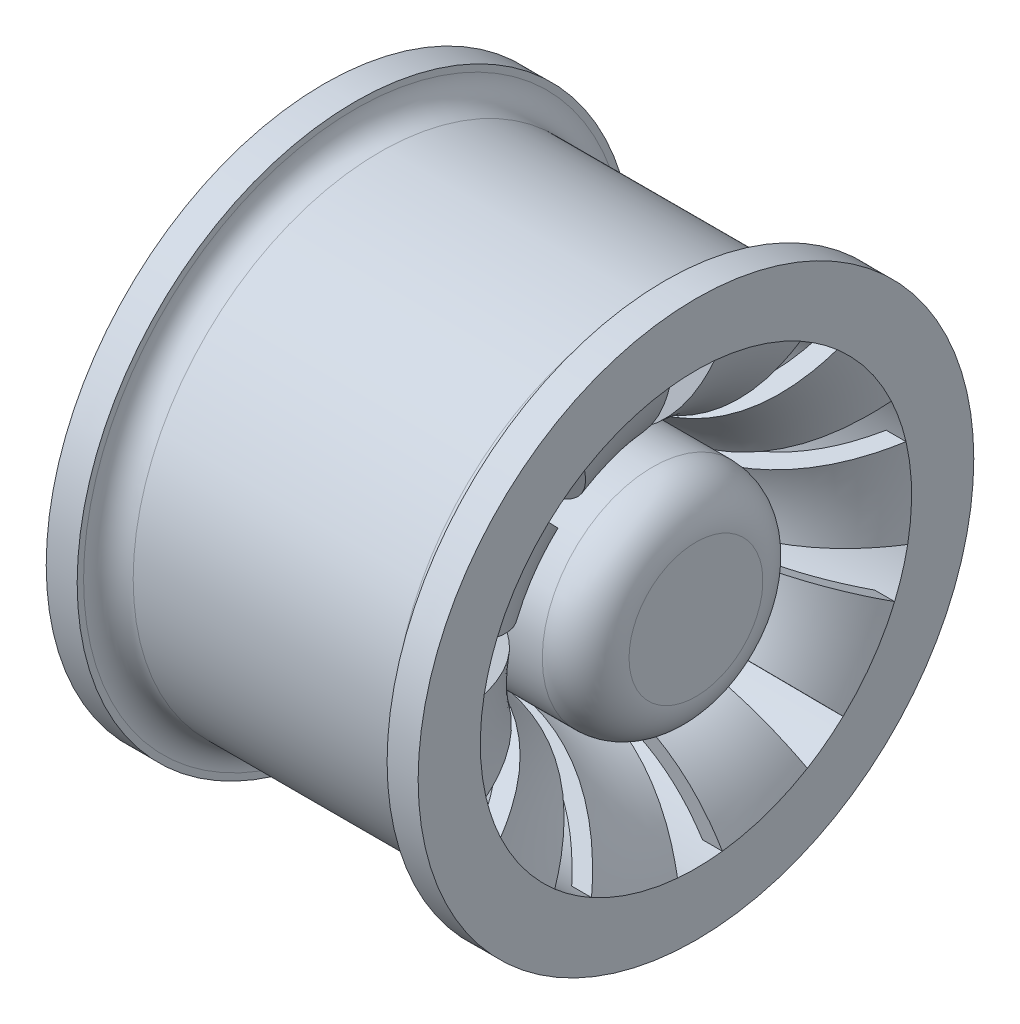
from build123d import *
from build123d.topology import SkipClean

# Parameters (mm, degrees)
SKETCH2_R           = 17.794539365
BOSS_EXTRUDE1_DEPTH = 59.999941
SKETCH3_R           = 4
CUT_EXTRUDE2_DEPTH  = 55
FILLET1_R           = 7
CUT_EXTRUDE3_START  = -29.99997065
CUT_EXTRUDE3_DEPTH  = 29.99997065
CIRPATTERN1_COUNT   = 10


# Read off the part's stored shape, not the designer's step: Cut-Extrude3
with BuildPart() as part:
    # Sketch1 → Revolve1 (revolve)
    with BuildSketch(Plane.XY, mode=Mode.PRIVATE) as revolve1_sk:
        with BuildLine():
            add(Edge.make_bspline(
                [(26.799484985, 0), (26.751531444, -0.1230055), (25.642099602, -2.895578008), (22.619699708, -7.577134188), (17.745379734, -11.816229683), (11.257778247, -13.998662024), (4.423335537, -14.503359557), (0.358852115, -14.018605819)],
                knots=[0.028010566, 0.028010566, 0.028010566, 0.035013208, 0.1875, 0.375, 0.625, 0.8125, 1, 1, 1], degree=2))
            add(Edge.make_bspline(
                [(0.358852115, -14.018605819), (0.179426058, -13.995489663), (0, -13.972373507)],
                knots=[0, 0, 0, 0.183393233, 0.183393233, 0.183393233], degree=2))
            Line((0, -13.972373507), (0, -16.997066018))
            add(Edge.make_bspline(
                [(29.99997065, 0), (22.987527729, -19.766659162), (0, -16.997066018)],
                knots=[0, 0, 0, 1, 1, 1], degree=2))
            Line((29.99997065, 0), (29.99997065, 10.02794636))
            Line((29.99997065, 10.02794636), (24.999999999, 10.034940236))
            Line((24.999999999, 10.034940236), (24.999999999, 9))
            ThreePointArc((24.999999999, 9), (23.828427124, 6.171572875), (20.999999999, 5))
            Line((20.999999999, 5), (-20.999999999, 5))
            ThreePointArc((-20.999999999, 5), (-23.828427124, 6.171572875), (-24.999999999, 9))
            Line((-24.999999999, 9), (-24.999999999, 10.034940236))
            Line((-24.999999999, 10.034940236), (-29.99997065, 10.02794636))
            Line((-29.99997065, 10.02794636), (-29.99997065, 0))
            Line((-29.99997065, 0), (26.799484985, 0))
        make_face()
    revolve(revolve1_sk.sketch.rotate(Axis((0, -34.791605384, 0), (1, 0, 0)), 90), axis=Axis((0, -34.791605384, 0), (1, 0, 0)))

    # Sketch2 → Boss-Extrude1 (add, through all)
    with BuildSketch(Plane.ZY.offset(29.99997065)):
        with Locations((0, -34.791605384)):
            Circle(SKETCH2_R)
    extrude(amount=-BOSS_EXTRUDE1_DEPTH)

    # Sketch3 → Cut-Extrude2 (cut)
    with BuildSketch(Plane.ZY.offset(29.99997065)):
        with Locations((0.077829223, -34.967638929)):
            Circle(SKETCH3_R)
    extrude(amount=-CUT_EXTRUDE2_DEPTH, mode=Mode.SUBTRACT)

    # Fillet1
    fillet1_edges = [part.edges().sort_by_distance(p)[0] for p in [
        (29.99997035, -34.791605384, -17.794539365),
    ]]
    fillet(fillet1_edges, radius=FILLET1_R)

    # Cut-Extrude3 outline → Cut-Extrude3 (cut)
    with SkipClean():  # the faces are left unmerged after this step: merging them gives an invalid solid
        with BuildSketch(Plane(origin=(29.99997065, 0, 0), x_dir=(0, 0, -1), z_dir=(1, 0, 0)).offset(CUT_EXTRUDE3_START)):
            with BuildLine():
                Line((-4.266263649, -0.262562541), (-1.742127872, -17.08255059))
                ThreePointArc((-1.742127872, -17.08255059), (-0.685960744, -17.010292467), (0.372634218, -17.000968101))
                Line((0.372634218, -17.000968101), (2.973078645, -0.127263351))
                ThreePointArc((2.973078645, -0.127263351), (-0.650121782, -0.006074673), (-4.266263649, -0.262562541))
            make_face()
        cut_extrude3 = extrude(amount=CUT_EXTRUDE3_DEPTH, mode=Mode.SUBTRACT)

    # CirPattern1: Cut-Extrude3 ×10 about axis
    with SkipClean():  # the faces are left unmerged after this step: merging them gives an invalid solid
        cirpattern1_axis = Axis((0, -34.791605384, 0), (1, 0, 0))
        for i in range(1, CIRPATTERN1_COUNT):
            add(cut_extrude3.rotate(cirpattern1_axis, i * 360 / CIRPATTERN1_COUNT), mode=Mode.SUBTRACT)


solid = part.part
